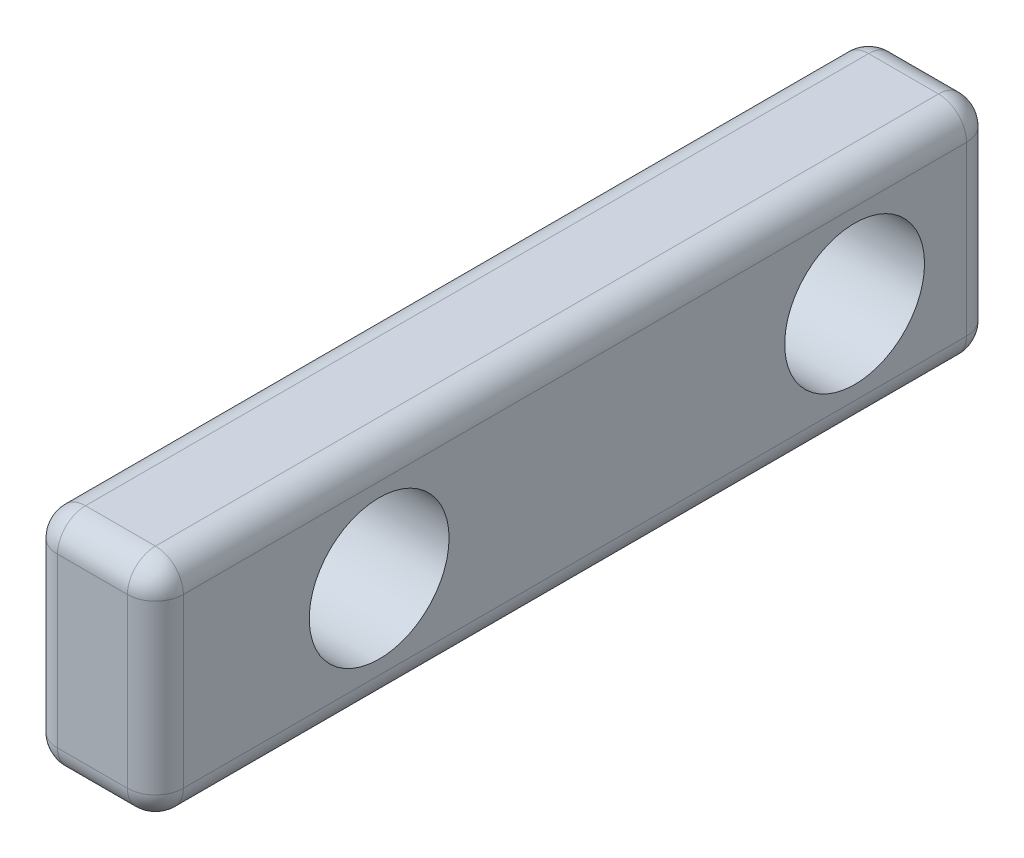
from build123d import *

# Parameters (mm, degrees)
SKETCH_1_W          = 4.5
SKETCH_1_H          = 8
EXTRUDE_1_DEPTH     = 30
SKETCH_4_R          = 2.5
CUT_EXTRUDE_2_DEPTH = 32.372758884
SKETCH_7_R          = 3.5
CUT_EXTRUDE_4_DEPTH = 0.5
FILLET_1_R          = 1


with BuildPart() as part:
    # 草图1 → 凸台-拉伸1 (new body)
    with BuildSketch(Plane.XY):
        with Locations((2.25, 4)):
            Rectangle(SKETCH_1_W, SKETCH_1_H)
    extrude(amount=EXTRUDE_1_DEPTH)

    # 草图4 → 切除-拉伸2 (cut, through all)
    with BuildSketch(Plane(origin=(4.5, 0, 0), x_dir=(0, 0, -1), z_dir=(1, 0, 0))):
        with Locations((-5, 4)):
            Circle(SKETCH_4_R)
        with Locations((-22, 4)):
            Circle(SKETCH_4_R)
    extrude(amount=-CUT_EXTRUDE_2_DEPTH, mode=Mode.SUBTRACT)

    # 草图7 → 切除-拉伸4 (cut)
    with BuildSketch(Plane.ZY):
        with Locations((5, 4)):
            Circle(SKETCH_7_R)
        with Locations((22, 4)):
            Circle(SKETCH_7_R)
    extrude(amount=-CUT_EXTRUDE_4_DEPTH, mode=Mode.SUBTRACT)

    # 圆角1
    # the kernel refuses this fillet: 1 mm, written as the material it takes off along each edge
    with BuildSketch(Plane(origin=(3.5, 7, 29), x_dir=(1, 0, 0), z_dir=(0, 1, 0))) as fillet_1_piece_1_section:
        Polygon((0, 0), (FILLET_1_R, 0), (FILLET_1_R, -FILLET_1_R), (0, -FILLET_1_R), align=None)
    fillet_1_piece_1 = extrude(amount=FILLET_1_R, mode=Mode.PRIVATE)
    fillet_1_piece_1 = fillet_1_piece_1 - Plane(origin=(3.5, 7, 29), x_dir=(-0.7071067811865475, 0, -0.7071067811865475), z_dir=(0, 1, 0)) * Sphere(FILLET_1_R, mode=Mode.PRIVATE)
    add(fillet_1_piece_1, mode=Mode.SUBTRACT)
    with BuildSketch(Plane(origin=(3.5, 1, 29), x_dir=(0, 0, 1), z_dir=(1, 0, 0))) as fillet_1_piece_2_section:
        Polygon((0, 0), (FILLET_1_R, 0), (FILLET_1_R, FILLET_1_R), (0, FILLET_1_R), align=None)
    fillet_1_piece_2 = extrude(amount=FILLET_1_R, mode=Mode.PRIVATE)
    fillet_1_piece_2 = fillet_1_piece_2 - Plane(origin=(3.5, 1, 29), x_dir=(0, 0.7071067811865475, -0.7071067811865475), z_dir=(1, 0, 0)) * Sphere(FILLET_1_R, mode=Mode.PRIVATE)
    add(fillet_1_piece_2, mode=Mode.SUBTRACT)
    with BuildSketch(Plane(origin=(1, 7, 29), x_dir=(-1, 0, 0), z_dir=(0, 1, 0))) as fillet_1_piece_3_section:
        Polygon((0, 0), (FILLET_1_R, 0), (FILLET_1_R, FILLET_1_R), (0, FILLET_1_R), align=None)
    fillet_1_piece_3 = extrude(amount=FILLET_1_R, mode=Mode.PRIVATE)
    fillet_1_piece_3 = fillet_1_piece_3 - Plane(origin=(1, 7, 29), x_dir=(0.7071067811865475, 0, -0.7071067811865475), z_dir=(0, 1, 0)) * Sphere(FILLET_1_R, mode=Mode.PRIVATE)
    add(fillet_1_piece_3, mode=Mode.SUBTRACT)
    with BuildSketch(Plane(origin=(1, 1, 29), x_dir=(0, 0, 1), z_dir=(-1, 0, 0))) as fillet_1_piece_4_section:
        Polygon((0, 0), (FILLET_1_R, 0), (FILLET_1_R, -FILLET_1_R), (0, -FILLET_1_R), align=None)
    fillet_1_piece_4 = extrude(amount=FILLET_1_R, mode=Mode.PRIVATE)
    fillet_1_piece_4 = fillet_1_piece_4 - Plane(origin=(1, 1, 29), x_dir=(0, 0.7071067811865475, -0.7071067811865475), z_dir=(-1, 0, 0)) * Sphere(FILLET_1_R, mode=Mode.PRIVATE)
    add(fillet_1_piece_4, mode=Mode.SUBTRACT)
    with BuildSketch(Plane(origin=(1, 7, 1), x_dir=(-1, 0, 0), z_dir=(0, 1, 0))) as fillet_1_piece_5_section:
        Polygon((0, 0), (FILLET_1_R, 0), (FILLET_1_R, -FILLET_1_R), (0, -FILLET_1_R), align=None)
    fillet_1_piece_5 = extrude(amount=FILLET_1_R, mode=Mode.PRIVATE)
    fillet_1_piece_5 = fillet_1_piece_5 - Plane(origin=(1, 7, 1), x_dir=(0.7071067811865475, 0, 0.7071067811865475), z_dir=(0, 1, 0)) * Sphere(FILLET_1_R, mode=Mode.PRIVATE)
    add(fillet_1_piece_5, mode=Mode.SUBTRACT)
    with BuildSketch(Plane(origin=(3.5, 7, 1), x_dir=(1, 0, 0), z_dir=(0, 1, 0))) as fillet_1_piece_6_section:
        Polygon((0, 0), (FILLET_1_R, 0), (FILLET_1_R, FILLET_1_R), (0, FILLET_1_R), align=None)
    fillet_1_piece_6 = extrude(amount=FILLET_1_R, mode=Mode.PRIVATE)
    fillet_1_piece_6 = fillet_1_piece_6 - Plane(origin=(3.5, 7, 1), x_dir=(-0.7071067811865475, 0, 0.7071067811865475), z_dir=(0, 1, 0)) * Sphere(FILLET_1_R, mode=Mode.PRIVATE)
    add(fillet_1_piece_6, mode=Mode.SUBTRACT)
    with BuildSketch(Plane(origin=(3.5, 1, 1), x_dir=(0, 0, -1), z_dir=(1, 0, 0))) as fillet_1_piece_7_section:
        Polygon((0, 0), (FILLET_1_R, 0), (FILLET_1_R, -FILLET_1_R), (0, -FILLET_1_R), align=None)
    fillet_1_piece_7 = extrude(amount=FILLET_1_R, mode=Mode.PRIVATE)
    fillet_1_piece_7 = fillet_1_piece_7 - Plane(origin=(3.5, 1, 1), x_dir=(0, 0.7071067811865475, 0.7071067811865475), z_dir=(1, 0, 0)) * Sphere(FILLET_1_R, mode=Mode.PRIVATE)
    add(fillet_1_piece_7, mode=Mode.SUBTRACT)
    with BuildSketch(Plane(origin=(1, 1, 1), x_dir=(0, 0, -1), z_dir=(-1, 0, 0))) as fillet_1_piece_8_section:
        Polygon((0, 0), (FILLET_1_R, 0), (FILLET_1_R, FILLET_1_R), (0, FILLET_1_R), align=None)
    fillet_1_piece_8 = extrude(amount=FILLET_1_R, mode=Mode.PRIVATE)
    fillet_1_piece_8 = fillet_1_piece_8 - Plane(origin=(1, 1, 1), x_dir=(0, 0.7071067811865475, 0.7071067811865475), z_dir=(-1, 0, 0)) * Sphere(FILLET_1_R, mode=Mode.PRIVATE)
    add(fillet_1_piece_8, mode=Mode.SUBTRACT)
    with BuildSketch(Plane(origin=(4.5, 7, 30), x_dir=(0, 0, -1), z_dir=(0, -1, 0)), Plane(origin=(0, 1, 30), x_dir=(0, 0, -1), z_dir=(0, 1, 0))) as fillet_1_piece_9:
        with BuildLine():
            CenterArc((FILLET_1_R, -FILLET_1_R), FILLET_1_R, 90, 90)
            Line((0, -FILLET_1_R), (0, 0))
            Line((0, 0), (FILLET_1_R, 0))
        make_face()
    extrude(amount=6, mode=Mode.SUBTRACT)
    with BuildSketch(Plane(origin=(1, 8, 30), x_dir=(0, 0, -1), z_dir=(1, 0, 0)), Plane(origin=(3.5, 0, 0), x_dir=(0, 1, 0), z_dir=(-1, 0, 0))) as fillet_1_piece_10:
        with BuildLine():
            CenterArc((FILLET_1_R, -FILLET_1_R), FILLET_1_R, 90, 90)
            Line((0, -FILLET_1_R), (0, 0))
            Line((0, 0), (FILLET_1_R, 0))
        make_face()
    extrude(amount=2.5, mode=Mode.SUBTRACT)
    with BuildSketch(Plane(origin=(1, 8, 0), x_dir=(0, 0, 1), z_dir=(1, 0, 0)), Plane(origin=(3.5, 0, 30), x_dir=(0, 1, 0), z_dir=(-1, 0, 0))) as fillet_1_piece_11:
        with BuildLine():
            CenterArc((FILLET_1_R, FILLET_1_R), FILLET_1_R, 180, 90)
            Line((0, FILLET_1_R), (0, 0))
            Line((0, 0), (FILLET_1_R, 0))
        make_face()
    extrude(amount=2.5, mode=Mode.SUBTRACT)
    with BuildSketch(Plane(origin=(4.5, 7, 0), x_dir=(0, 0, 1), z_dir=(0, -1, 0)), Plane(origin=(0, 1, 0), x_dir=(0, 0, 1), z_dir=(0, 1, 0))) as fillet_1_piece_12:
        with BuildLine():
            CenterArc((FILLET_1_R, FILLET_1_R), FILLET_1_R, 180, 90)
            Line((0, FILLET_1_R), (0, 0))
            Line((0, 0), (FILLET_1_R, 0))
        make_face()
    extrude(amount=6, mode=Mode.SUBTRACT)
    with BuildSketch(Plane(origin=(0, 8, 1), x_dir=(1, 0, 0), z_dir=(0, 0, 1)), Plane(origin=(0, 0, 1), x_dir=(0, 1, 0), z_dir=(0, 0, 1))) as fillet_1_piece_13:
        with BuildLine():
            CenterArc((FILLET_1_R, -FILLET_1_R), FILLET_1_R, 90, 90)
            Line((0, -FILLET_1_R), (0, 0))
            Line((0, 0), (FILLET_1_R, 0))
        make_face()
    extrude(amount=28, mode=Mode.SUBTRACT)
    with BuildSketch(Plane(origin=(4.5, 8, 1), x_dir=(-1, 0, 0), z_dir=(0, 0, 1)), Plane(origin=(4.5, 0, 1), x_dir=(0, 1, 0), z_dir=(0, 0, 1))) as fillet_1_piece_14:
        with BuildLine():
            CenterArc((FILLET_1_R, FILLET_1_R), FILLET_1_R, 180, 90)
            Line((0, FILLET_1_R), (0, 0))
            Line((0, 0), (FILLET_1_R, 0))
        make_face()
    extrude(amount=28, mode=Mode.SUBTRACT)


solid = part.part
